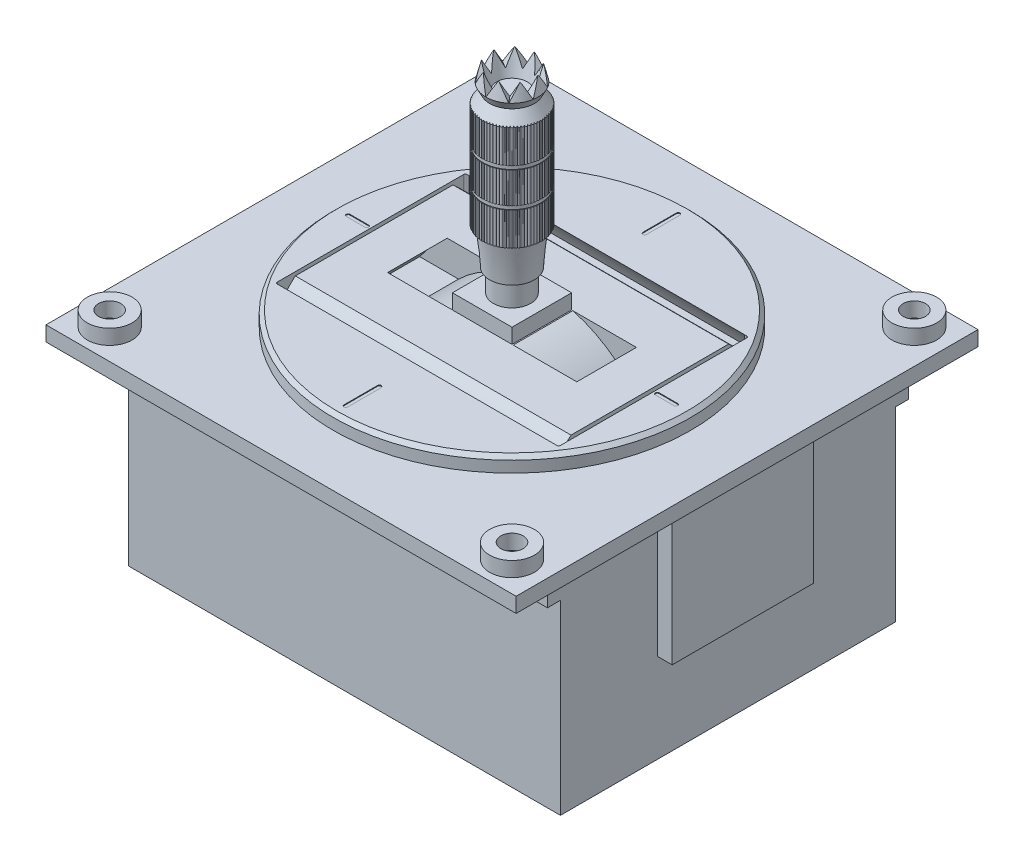
from build123d import *

# Parameters (mm, degrees)
SKETCH1_R                      = 24
CENTREOFFSET_DEPTH             = 2
MAINBODY_START                 = -2
SKETCH1_3_W                    = 63.1
SKETCH1_3_H                    = 62
SKETCH1_3_R                    = 3
SKETCH1_3_R_2                  = 24
MAINBODY_DEPTH                 = 2
SKETCH1_4_R                    = 3
SKETCH1_4_R_2                  = 1.5
SCREWHOLES_DEPTH               = 2
SCREWHOLES_2_DEPTH             = 2
SCREWHOLES_3_DEPTH             = 2
SCREWHOLES_4_DEPTH             = 2
SKETCH15_W                     = 37
SKETCH15_H                     = 1.5
PIVOTCUTOUTX_ANGLE             = 70
PIVOTCUTOUTX_OTHER_WAY_ANGLE   = 70
SKETCH20_W                     = 8
SKETCH20_H                     = 4
PIVOTCUTOUTY_ANGLE             = 90
PIVOTCUTOUTY_OTHER_WAY_ANGLE   = 90
SKETCH2_W                      = 8
SKETCH2_H                      = 8
STICKBASE_DEPTH                = 2
STICKBOTTOMSKETCH_R            = 2.5
STICKBOTTOM_DEPTH              = 3
SKETCH6_R                      = 4
SKETCH7_R                      = 4
SKETCH8_R                      = 3
SKETCH9_R                      = 3.5
SKETCH10_R                     = 3
CUT_EXTRUDE1_DEPTH             = 54.727576775
SPIKYBIT_COUNT                 = 9
INDENTSKETCH_W                 = 0.2
INDENTSKETCH_H                 = 0.5
CUT_EXTRUDE3_REACH             = 54.349
SKETCH14_R                     = 5
CUT_EXTRUDE3_DIRECTION_2_DEPTH = 53.348853856
CUT_EXTRUDE4_DEPTH             = 10
SKETCH17_W                     = 58
SKETCH17_H                     = 48.5
LIP_DEPTH                      = 4
SKETCH18_W                     = 58
SKETCH18_H                     = 45
BOTTOM_DEPTH                   = 25
SKETCH19_W                     = 2
SKETCH19_H                     = 19
BEARINGHOLDER_DEPTH            = 17
INDICATORS_DEPTH               = 0.1
CHAMFER2_SIZE                  = 0.5


with BuildPart() as part:
    # Sketch1 → CentreOffset (new body)
    with BuildSketch(Plane(origin=(0, 0, 0), x_dir=(1, 0, 0), z_dir=(0, 1, 0))):
        with Locations(Location((0, 0, 0), (0, 0, 90))):
            Circle(SKETCH1_R)
    extrude(amount=CENTREOFFSET_DEPTH)

    # Sketch1<3> → MainBody (add)
    # profile 1 of 2: a face of its own
    with BuildSketch(Plane(origin=(0, 0, 0), x_dir=(1, 0, 0), z_dir=(0, 1, 0)).offset(MAINBODY_START)):
        Rectangle(SKETCH1_3_W, SKETCH1_3_H)
        with Locations(Location((-27, 27, 0), (0, 0, 270))):
            Circle(SKETCH1_3_R, mode=Mode.SUBTRACT)
        with Locations(Location((27, 27, 0), (0, 0, 270))):
            Circle(SKETCH1_3_R, mode=Mode.SUBTRACT)
        with Locations(Location((0, 0, 0), (0, 0, 90))):
            Circle(SKETCH1_3_R_2, mode=Mode.SUBTRACT)
        with Locations(Location((-27, -27, 0), (0, 0, 270))):
            Circle(SKETCH1_3_R, mode=Mode.SUBTRACT)
        with Locations(Location((27, -27, 0), (0, 0, 270))):
            Circle(SKETCH1_3_R, mode=Mode.SUBTRACT)
    # profile 2 of 2: a face of its own
    with BuildSketch(Plane(origin=(0, 0, 0), x_dir=(1, 0, 0), z_dir=(0, 1, 0)).offset(MAINBODY_START)):
        with Locations(Location((0, 0, 0), (0, 0, 90))):
            Circle(SKETCH1_3_R_2)
    extrude(amount=MAINBODY_DEPTH)

    # Sketch15 → PivotCutoutX (revolve, cut)
    with BuildSketch(Plane.XY):
        with Locations((0, 6.75)):
            Rectangle(SKETCH15_W, SKETCH15_H)
    revolve(axis=Axis((-31.55, -10, 0), (1, 0, 0)), revolution_arc=PIVOTCUTOUTX_ANGLE, mode=Mode.SUBTRACT)

    # Sketch15 → PivotCutoutX other way (revolve, cut)
    with BuildSketch(Plane.XY):
        with Locations((0, 6.75)):
            Rectangle(SKETCH15_W, SKETCH15_H)
    revolve(axis=Axis((-31.55, -10, 0), (-1, 0, 0)), revolution_arc=PIVOTCUTOUTX_OTHER_WAY_ANGLE, mode=Mode.SUBTRACT)

    # Sketch20 → PivotCutoutY (revolve, cut)
    with BuildSketch(Plane(origin=(0, 0, 0), x_dir=(0, 0, -1), z_dir=(1, 0, 0))):
        with Locations((0, 4.55)):
            Rectangle(SKETCH20_W, SKETCH20_H)
    revolve(axis=Axis((0, -13.45, 22.5), (0, 0, -1)), revolution_arc=PIVOTCUTOUTY_ANGLE, mode=Mode.SUBTRACT)

    # Sketch20 → PivotCutoutY other way (revolve, cut)
    with BuildSketch(Plane(origin=(0, 0, 0), x_dir=(0, 0, -1), z_dir=(1, 0, 0))):
        with Locations((0, 4.55)):
            Rectangle(SKETCH20_W, SKETCH20_H)
    revolve(axis=Axis((0, -13.45, 22.5), (0, 0, 1)), revolution_arc=PIVOTCUTOUTY_OTHER_WAY_ANGLE, mode=Mode.SUBTRACT)

    # Sketch2 → StickBase (add)
    with BuildSketch(Plane(origin=(0, 2, 0), x_dir=(1, 0, 0), z_dir=(0, 1, 0))):
        Rectangle(SKETCH2_W, SKETCH2_H)
    extrude(amount=STICKBASE_DEPTH)

    # StickBottomSketch → StickBottom (add)
    with BuildSketch(Plane(origin=(0, 4, 0), x_dir=(1, 0, 0), z_dir=(0, 1, 0))):
        with Locations(Location((0, 0, 0), (0, 0, 270))):
            Circle(STICKBOTTOMSKETCH_R)
    extrude(amount=STICKBOTTOM_DEPTH)

    # Loft1: read off the stored shape, not the designer's step
    # Loft1: loft between two sections, ruled curve by curve
    loft1_from = [
        Edge.make_bspline([(-0.3666474, 7, 2.977510652), (5.588373905, 7, 3.710805452), (6.321668704, 7, -2.244215853), (0.3666474, 7, -2.977510652), (-5.588373905, 7, -3.710805452), (-6.321668704, 7, 2.244215853), (-0.3666474, 7, 2.977510652)], [0, 0, 0, 0, 0.5, 0.5, 0.5, 1, 1, 1, 1], 3, [1, 0.333333333, 0.333333333, 1, 0.333333333, 0.333333333, 1]),
    ]
    loft1_to = [
        Edge.make_bspline([(0.912945272, 12, 3.378835736), (7.670616744, 12, 1.552945192), (5.8447262, 12, -5.20472628), (-0.912945272, 12, -3.378835736), (-7.670616744, 12, -1.552945192), (-5.8447262, 12, 5.20472628), (0.912945272, 12, 3.378835736)], [0, 0, 0, 0, 0.5, 0.5, 0.5, 1, 1, 1, 1], 3, [1, 0.333333333, 0.333333333, 1, 0.333333333, 0.333333333, 1]),
    ]
    loft1 = Solid(Shell([*[Face.make_surface_from_curves(loft1_from[k], loft1_to[k]) for k in range(1)], Face(Wire(loft1_from)), Face(Wire(loft1_to))]))
    add(loft1)

    # Sketch6 → Loft2 section 0
    with BuildSketch(Plane(origin=(0, 12, 0), x_dir=(1, 0, 0), z_dir=(0, 1, 0))):
        Circle(SKETCH6_R)
    # Sketch7 → Loft2 section 1
    with BuildSketch(Plane(origin=(0, 26, 0), x_dir=(1, 0, 0), z_dir=(0, 1, 0))):
        Circle(SKETCH7_R)
    loft()

    # Sketch8 → section 1 of loft3
    with BuildSketch(Plane(origin=(0, 27.5, 0), x_dir=(1, 0, 0), z_dir=(0, 1, 0)), mode=Mode.PRIVATE) as loft3_s1:
        Circle(SKETCH8_R)
    # loft up to a face of the part (loft3)
    loft([Face(Wire([part.edges().sort_by_distance((-2.738188424, 26, -2.91587451))[0]])), loft3_s1.sketch])

    # Sketch9 → section 1 of loft4
    with BuildSketch(Plane(origin=(0, 28.5, 0), x_dir=(1, 0, 0), z_dir=(0, 1, 0)), mode=Mode.PRIVATE) as loft4_s1:
        Circle(SKETCH9_R)
    # loft up to a face of the part (loft4)
    loft([Face(Wire([part.edges().sort_by_distance((-2.053641318, 27.5, -2.186905882))[0]])), loft4_s1.sketch])

    # Sketch10 → section 1 of loft5
    with BuildSketch(Plane(origin=(0, 30.5, 0), x_dir=(1, 0, 0), z_dir=(0, 1, 0)), mode=Mode.PRIVATE) as loft5_s1:
        Circle(SKETCH10_R)
    # loft up to a face of the part (loft5)
    loft([Face(Wire([part.edges().sort_by_distance((-2.395914871, 28.5, -2.551390196))[0]])), loft5_s1.sketch])

    # Sketch12 → Cut-Revolve1 (revolve, cut)
    with BuildSketch(Plane.XY, mode=Mode.PRIVATE) as cut_revolve1_sk:
        Polygon((0, 30.5), (3, 30.5), (2.040418312, 27.5), (0, 27.5), align=None)
    revolve(cut_revolve1_sk.sketch.rotate(Axis((0, 30.5, 0), (0, -1, 0)), 180), axis=Axis((0, 30.5, 0), (0, -1, 0)), mode=Mode.SUBTRACT)

    # Sketch13 → Cut-Extrude1 (cut, through all)
    with BuildSketch(Plane.XY):
        Polygon((-1, 30.5), (1, 30.5), (0, 28.5), align=None)
    cut_extrude1 = extrude(amount=CUT_EXTRUDE1_DEPTH, mode=Mode.SUBTRACT)

    # SpikyBit: Cut-Extrude1 ×9 about axis
    spikybit_axis = Axis((0, 0, 0), (0, 1, 0))
    for i in range(1, SPIKYBIT_COUNT):
        add(cut_extrude1.rotate(spikybit_axis, i * 360 / SPIKYBIT_COUNT), mode=Mode.SUBTRACT)

    # IndentSketch → Cut-Revolve3 (revolve, cut)
    with BuildSketch(Plane.XY, mode=Mode.PRIVATE) as cut_revolve3_sk:
        with Locations((4, 16.666666667)):
            Rectangle(INDENTSKETCH_W, INDENTSKETCH_H)
        with Locations((4, 21.333333333)):
            Rectangle(INDENTSKETCH_W, INDENTSKETCH_H)
    revolve(cut_revolve3_sk.sketch.rotate(Axis((0, 30.5, 0), (0, -1, 0)), 180), axis=Axis((0, 30.5, 0), (0, -1, 0)), mode=Mode.SUBTRACT)

    # Cut-Extrude3: up to this face of the body (flat: up to its plane)
    cut_extrude3_end = Plane(part.part.faces().sort_by_distance((0, 4, 3.886862915))[0])
    # Sketch14 → Cut-Extrude3 (cut, up to the picked face)
    with BuildSketch(Plane(origin=(0, 26, 0), x_dir=(1, 0, 0), z_dir=(0, 1, 0)), mode=Mode.PRIVATE) as cut_extrude3_sk1:
        Circle(SKETCH14_R)
        with BuildLine():
            ThreePointArc((-0.170350384, 3.901665246), (0, 4.000017085), (0.170350384, 3.901665246))
            ThreePointArc((0.170350384, 3.901665246), (0.34862446, 3.984795813), (0.509754681, 3.871971217))
            ThreePointArc((0.509754681, 3.871971217), (0.694595678, 3.939247838), (0.845279438, 3.81280915))
            ThreePointArc((0.845279438, 3.81280915), (1.035280602, 3.863719808), (1.174371108, 3.724629303))
            ThreePointArc((1.174371108, 3.724629303), (1.368086417, 3.758786538), (1.494525105, 3.608102778))
            ThreePointArc((1.494525105, 3.608102778), (1.690480268, 3.625246633), (1.803304863, 3.464116412))
            ThreePointArc((1.803304863, 3.464116412), (2.000008543, 3.464116412), (2.098360383, 3.293766028))
            ThreePointArc((2.098360383, 3.293766028), (2.294315545, 3.276622173), (2.377446112, 3.098348096))
            ThreePointArc((2.377446112, 3.098348096), (2.571161421, 3.064190861), (2.638438042, 2.879349865))
            ThreePointArc((2.638438042, 2.879349865), (2.828439206, 2.828439206), (2.879349865, 2.638438042))
            ThreePointArc((2.879349865, 2.638438042), (3.064190861, 2.571161421), (3.098348096, 2.377446112))
            ThreePointArc((3.098348096, 2.377446112), (3.276622173, 2.294315545), (3.293766028, 2.098360383))
            ThreePointArc((3.293766028, 2.098360383), (3.464116412, 2.000008543), (3.464116412, 1.803304863))
            ThreePointArc((3.464116412, 1.803304863), (3.625246633, 1.690480268), (3.608102778, 1.494525105))
            ThreePointArc((3.608102778, 1.494525105), (3.758786538, 1.368086417), (3.724629303, 1.174371108))
            ThreePointArc((3.724629303, 1.174371108), (3.863719808, 1.035280602), (3.81280915, 0.845279438))
            ThreePointArc((3.81280915, 0.845279438), (3.939247838, 0.694595678), (3.871971217, 0.509754681))
            ThreePointArc((3.871971217, 0.509754681), (3.984795813, 0.34862446), (3.901665246, 0.170350384))
            ThreePointArc((3.901665246, 0.170350384), (4.000017085, 0), (3.901665246, -0.170350384))
            ThreePointArc((3.901665246, -0.170350384), (3.984795813, -0.34862446), (3.871971217, -0.509754681))
            ThreePointArc((3.871971217, -0.509754681), (3.939247838, -0.694595678), (3.81280915, -0.845279438))
            ThreePointArc((3.81280915, -0.845279438), (3.863719808, -1.035280602), (3.724629303, -1.174371108))
            ThreePointArc((3.724629303, -1.174371108), (3.758786538, -1.368086417), (3.608102778, -1.494525105))
            ThreePointArc((3.608102778, -1.494525105), (3.625246633, -1.690480268), (3.464116412, -1.803304863))
            ThreePointArc((3.464116412, -1.803304863), (3.464116412, -2.000008543), (3.293766028, -2.098360383))
            ThreePointArc((3.293766028, -2.098360383), (3.276622173, -2.294315545), (3.098348096, -2.377446112))
            ThreePointArc((3.098348096, -2.377446112), (3.064190861, -2.571161421), (2.879349865, -2.638438042))
            ThreePointArc((2.879349865, -2.638438042), (2.828439206, -2.828439206), (2.638438042, -2.879349865))
            ThreePointArc((2.638438042, -2.879349865), (2.571161421, -3.064190861), (2.377446112, -3.098348096))
            ThreePointArc((2.377446112, -3.098348096), (2.294315545, -3.276622173), (2.098360383, -3.293766028))
            ThreePointArc((2.098360383, -3.293766028), (2.000008543, -3.464116412), (1.803304863, -3.464116412))
            ThreePointArc((1.803304863, -3.464116412), (1.690480268, -3.625246633), (1.494525105, -3.608102778))
            ThreePointArc((1.494525105, -3.608102778), (1.368086417, -3.758786538), (1.174371108, -3.724629303))
            ThreePointArc((1.174371108, -3.724629303), (1.035280602, -3.863719808), (0.845279438, -3.81280915))
            ThreePointArc((0.845279438, -3.81280915), (0.694595678, -3.939247838), (0.509754681, -3.871971217))
            ThreePointArc((0.509754681, -3.871971217), (0.34862446, -3.984795813), (0.170350384, -3.901665246))
            ThreePointArc((0.170350384, -3.901665246), (0, -4.000017085), (-0.170350384, -3.901665246))
            ThreePointArc((-0.170350384, -3.901665246), (-0.34862446, -3.984795813), (-0.509754681, -3.871971217))
            ThreePointArc((-0.509754681, -3.871971217), (-0.694595678, -3.939247838), (-0.845279438, -3.81280915))
            ThreePointArc((-0.845279438, -3.81280915), (-1.035280602, -3.863719808), (-1.174371108, -3.724629303))
            ThreePointArc((-1.174371108, -3.724629303), (-1.368086417, -3.758786538), (-1.494525105, -3.608102778))
            ThreePointArc((-1.494525105, -3.608102778), (-1.690480268, -3.625246633), (-1.803304863, -3.464116412))
            ThreePointArc((-1.803304863, -3.464116412), (-2.000008543, -3.464116412), (-2.098360383, -3.293766028))
            ThreePointArc((-2.098360383, -3.293766028), (-2.294315545, -3.276622173), (-2.377446112, -3.098348096))
            ThreePointArc((-2.377446112, -3.098348096), (-2.571161421, -3.064190861), (-2.638438042, -2.879349865))
            ThreePointArc((-2.638438042, -2.879349865), (-2.828439206, -2.828439206), (-2.879349865, -2.638438042))
            ThreePointArc((-2.879349865, -2.638438042), (-3.064190861, -2.571161421), (-3.098348096, -2.377446112))
            ThreePointArc((-3.098348096, -2.377446112), (-3.276622173, -2.294315545), (-3.293766028, -2.098360383))
            ThreePointArc((-3.293766028, -2.098360383), (-3.464116412, -2.000008543), (-3.464116412, -1.803304863))
            ThreePointArc((-3.464116412, -1.803304863), (-3.625246633, -1.690480268), (-3.608102778, -1.494525105))
            ThreePointArc((-3.608102778, -1.494525105), (-3.758786538, -1.368086417), (-3.724629303, -1.174371108))
            ThreePointArc((-3.724629303, -1.174371108), (-3.863719808, -1.035280602), (-3.81280915, -0.845279438))
            ThreePointArc((-3.81280915, -0.845279438), (-3.939247838, -0.694595678), (-3.871971217, -0.509754681))
            ThreePointArc((-3.871971217, -0.509754681), (-3.984795813, -0.34862446), (-3.901665246, -0.170350384))
            ThreePointArc((-3.901665246, -0.170350384), (-4.000017085, 0), (-3.901665246, 0.170350384))
            ThreePointArc((-3.901665246, 0.170350384), (-3.984795813, 0.34862446), (-3.871971217, 0.509754681))
            ThreePointArc((-3.871971217, 0.509754681), (-3.939247838, 0.694595678), (-3.81280915, 0.845279438))
            ThreePointArc((-3.81280915, 0.845279438), (-3.863719808, 1.035280602), (-3.724629303, 1.174371108))
            ThreePointArc((-3.724629303, 1.174371108), (-3.758786538, 1.368086417), (-3.608102778, 1.494525105))
            ThreePointArc((-3.608102778, 1.494525105), (-3.625246633, 1.690480268), (-3.464116412, 1.803304863))
            ThreePointArc((-3.464116412, 1.803304863), (-3.464116412, 2.000008543), (-3.293766028, 2.098360383))
            ThreePointArc((-3.293766028, 2.098360383), (-3.276622173, 2.294315545), (-3.098348096, 2.377446112))
            ThreePointArc((-3.098348096, 2.377446112), (-3.064190861, 2.571161421), (-2.879349865, 2.638438042))
            ThreePointArc((-2.879349865, 2.638438042), (-2.828439206, 2.828439206), (-2.638438042, 2.879349865))
            ThreePointArc((-2.638438042, 2.879349865), (-2.571161421, 3.064190861), (-2.377446112, 3.098348096))
            ThreePointArc((-2.377446112, 3.098348096), (-2.294315545, 3.276622173), (-2.098360383, 3.293766028))
            ThreePointArc((-2.098360383, 3.293766028), (-2.000008543, 3.464116412), (-1.803304863, 3.464116412))
            ThreePointArc((-1.803304863, 3.464116412), (-1.690480268, 3.625246633), (-1.494525105, 3.608102778))
            ThreePointArc((-1.494525105, 3.608102778), (-1.368086417, 3.758786538), (-1.174371108, 3.724629303))
            ThreePointArc((-1.174371108, 3.724629303), (-1.035280602, 3.863719808), (-0.845279438, 3.81280915))
            ThreePointArc((-0.845279438, 3.81280915), (-0.694595678, 3.939247838), (-0.509754681, 3.871971217))
            ThreePointArc((-0.509754681, 3.871971217), (-0.34862446, 3.984795813), (-0.170350384, 3.901665246))
        make_face(mode=Mode.SUBTRACT)
    cut_extrude3_tool1 = split(extrude(cut_extrude3_sk1.sketch, amount=-CUT_EXTRUDE3_REACH, mode=Mode.PRIVATE), bisect_by=cut_extrude3_end, keep=Keep.BOTH, mode=Mode.PRIVATE)
    add(cut_extrude3_tool1.solids().sort_by(Axis((-4.858579, 26, 0), (0, -1, 0)))[0], mode=Mode.SUBTRACT)

    # Sketch14 → Cut-Extrude3 direction 2 (cut)
    with BuildSketch(Plane(origin=(0, 26, 0), x_dir=(1, 0, 0), z_dir=(0, 1, 0))):
        Circle(SKETCH14_R)
        with BuildLine():
            ThreePointArc((-0.170350384, 3.901665246), (0, 4.000017085), (0.170350384, 3.901665246))
            ThreePointArc((0.170350384, 3.901665246), (0.34862446, 3.984795813), (0.509754681, 3.871971217))
            ThreePointArc((0.509754681, 3.871971217), (0.694595678, 3.939247838), (0.845279438, 3.81280915))
            ThreePointArc((0.845279438, 3.81280915), (1.035280602, 3.863719808), (1.174371108, 3.724629303))
            ThreePointArc((1.174371108, 3.724629303), (1.368086417, 3.758786538), (1.494525105, 3.608102778))
            ThreePointArc((1.494525105, 3.608102778), (1.690480268, 3.625246633), (1.803304863, 3.464116412))
            ThreePointArc((1.803304863, 3.464116412), (2.000008543, 3.464116412), (2.098360383, 3.293766028))
            ThreePointArc((2.098360383, 3.293766028), (2.294315545, 3.276622173), (2.377446112, 3.098348096))
            ThreePointArc((2.377446112, 3.098348096), (2.571161421, 3.064190861), (2.638438042, 2.879349865))
            ThreePointArc((2.638438042, 2.879349865), (2.828439206, 2.828439206), (2.879349865, 2.638438042))
            ThreePointArc((2.879349865, 2.638438042), (3.064190861, 2.571161421), (3.098348096, 2.377446112))
            ThreePointArc((3.098348096, 2.377446112), (3.276622173, 2.294315545), (3.293766028, 2.098360383))
            ThreePointArc((3.293766028, 2.098360383), (3.464116412, 2.000008543), (3.464116412, 1.803304863))
            ThreePointArc((3.464116412, 1.803304863), (3.625246633, 1.690480268), (3.608102778, 1.494525105))
            ThreePointArc((3.608102778, 1.494525105), (3.758786538, 1.368086417), (3.724629303, 1.174371108))
            ThreePointArc((3.724629303, 1.174371108), (3.863719808, 1.035280602), (3.81280915, 0.845279438))
            ThreePointArc((3.81280915, 0.845279438), (3.939247838, 0.694595678), (3.871971217, 0.509754681))
            ThreePointArc((3.871971217, 0.509754681), (3.984795813, 0.34862446), (3.901665246, 0.170350384))
            ThreePointArc((3.901665246, 0.170350384), (4.000017085, 0), (3.901665246, -0.170350384))
            ThreePointArc((3.901665246, -0.170350384), (3.984795813, -0.34862446), (3.871971217, -0.509754681))
            ThreePointArc((3.871971217, -0.509754681), (3.939247838, -0.694595678), (3.81280915, -0.845279438))
            ThreePointArc((3.81280915, -0.845279438), (3.863719808, -1.035280602), (3.724629303, -1.174371108))
            ThreePointArc((3.724629303, -1.174371108), (3.758786538, -1.368086417), (3.608102778, -1.494525105))
            ThreePointArc((3.608102778, -1.494525105), (3.625246633, -1.690480268), (3.464116412, -1.803304863))
            ThreePointArc((3.464116412, -1.803304863), (3.464116412, -2.000008543), (3.293766028, -2.098360383))
            ThreePointArc((3.293766028, -2.098360383), (3.276622173, -2.294315545), (3.098348096, -2.377446112))
            ThreePointArc((3.098348096, -2.377446112), (3.064190861, -2.571161421), (2.879349865, -2.638438042))
            ThreePointArc((2.879349865, -2.638438042), (2.828439206, -2.828439206), (2.638438042, -2.879349865))
            ThreePointArc((2.638438042, -2.879349865), (2.571161421, -3.064190861), (2.377446112, -3.098348096))
            ThreePointArc((2.377446112, -3.098348096), (2.294315545, -3.276622173), (2.098360383, -3.293766028))
            ThreePointArc((2.098360383, -3.293766028), (2.000008543, -3.464116412), (1.803304863, -3.464116412))
            ThreePointArc((1.803304863, -3.464116412), (1.690480268, -3.625246633), (1.494525105, -3.608102778))
            ThreePointArc((1.494525105, -3.608102778), (1.368086417, -3.758786538), (1.174371108, -3.724629303))
            ThreePointArc((1.174371108, -3.724629303), (1.035280602, -3.863719808), (0.845279438, -3.81280915))
            ThreePointArc((0.845279438, -3.81280915), (0.694595678, -3.939247838), (0.509754681, -3.871971217))
            ThreePointArc((0.509754681, -3.871971217), (0.34862446, -3.984795813), (0.170350384, -3.901665246))
            ThreePointArc((0.170350384, -3.901665246), (0, -4.000017085), (-0.170350384, -3.901665246))
            ThreePointArc((-0.170350384, -3.901665246), (-0.34862446, -3.984795813), (-0.509754681, -3.871971217))
            ThreePointArc((-0.509754681, -3.871971217), (-0.694595678, -3.939247838), (-0.845279438, -3.81280915))
            ThreePointArc((-0.845279438, -3.81280915), (-1.035280602, -3.863719808), (-1.174371108, -3.724629303))
            ThreePointArc((-1.174371108, -3.724629303), (-1.368086417, -3.758786538), (-1.494525105, -3.608102778))
            ThreePointArc((-1.494525105, -3.608102778), (-1.690480268, -3.625246633), (-1.803304863, -3.464116412))
            ThreePointArc((-1.803304863, -3.464116412), (-2.000008543, -3.464116412), (-2.098360383, -3.293766028))
            ThreePointArc((-2.098360383, -3.293766028), (-2.294315545, -3.276622173), (-2.377446112, -3.098348096))
            ThreePointArc((-2.377446112, -3.098348096), (-2.571161421, -3.064190861), (-2.638438042, -2.879349865))
            ThreePointArc((-2.638438042, -2.879349865), (-2.828439206, -2.828439206), (-2.879349865, -2.638438042))
            ThreePointArc((-2.879349865, -2.638438042), (-3.064190861, -2.571161421), (-3.098348096, -2.377446112))
            ThreePointArc((-3.098348096, -2.377446112), (-3.276622173, -2.294315545), (-3.293766028, -2.098360383))
            ThreePointArc((-3.293766028, -2.098360383), (-3.464116412, -2.000008543), (-3.464116412, -1.803304863))
            ThreePointArc((-3.464116412, -1.803304863), (-3.625246633, -1.690480268), (-3.608102778, -1.494525105))
            ThreePointArc((-3.608102778, -1.494525105), (-3.758786538, -1.368086417), (-3.724629303, -1.174371108))
            ThreePointArc((-3.724629303, -1.174371108), (-3.863719808, -1.035280602), (-3.81280915, -0.845279438))
            ThreePointArc((-3.81280915, -0.845279438), (-3.939247838, -0.694595678), (-3.871971217, -0.509754681))
            ThreePointArc((-3.871971217, -0.509754681), (-3.984795813, -0.34862446), (-3.901665246, -0.170350384))
            ThreePointArc((-3.901665246, -0.170350384), (-4.000017085, 0), (-3.901665246, 0.170350384))
            ThreePointArc((-3.901665246, 0.170350384), (-3.984795813, 0.34862446), (-3.871971217, 0.509754681))
            ThreePointArc((-3.871971217, 0.509754681), (-3.939247838, 0.694595678), (-3.81280915, 0.845279438))
            ThreePointArc((-3.81280915, 0.845279438), (-3.863719808, 1.035280602), (-3.724629303, 1.174371108))
            ThreePointArc((-3.724629303, 1.174371108), (-3.758786538, 1.368086417), (-3.608102778, 1.494525105))
            ThreePointArc((-3.608102778, 1.494525105), (-3.625246633, 1.690480268), (-3.464116412, 1.803304863))
            ThreePointArc((-3.464116412, 1.803304863), (-3.464116412, 2.000008543), (-3.293766028, 2.098360383))
            ThreePointArc((-3.293766028, 2.098360383), (-3.276622173, 2.294315545), (-3.098348096, 2.377446112))
            ThreePointArc((-3.098348096, 2.377446112), (-3.064190861, 2.571161421), (-2.879349865, 2.638438042))
            ThreePointArc((-2.879349865, 2.638438042), (-2.828439206, 2.828439206), (-2.638438042, 2.879349865))
            ThreePointArc((-2.638438042, 2.879349865), (-2.571161421, 3.064190861), (-2.377446112, 3.098348096))
            ThreePointArc((-2.377446112, 3.098348096), (-2.294315545, 3.276622173), (-2.098360383, 3.293766028))
            ThreePointArc((-2.098360383, 3.293766028), (-2.000008543, 3.464116412), (-1.803304863, 3.464116412))
            ThreePointArc((-1.803304863, 3.464116412), (-1.690480268, 3.625246633), (-1.494525105, 3.608102778))
            ThreePointArc((-1.494525105, 3.608102778), (-1.368086417, 3.758786538), (-1.174371108, 3.724629303))
            ThreePointArc((-1.174371108, 3.724629303), (-1.035280602, 3.863719808), (-0.845279438, 3.81280915))
            ThreePointArc((-0.845279438, 3.81280915), (-0.694595678, 3.939247838), (-0.509754681, 3.871971217))
            ThreePointArc((-0.509754681, 3.871971217), (-0.34862446, 3.984795813), (-0.170350384, 3.901665246))
        make_face(mode=Mode.SUBTRACT)
    extrude(amount=CUT_EXTRUDE3_DIRECTION_2_DEPTH, mode=Mode.SUBTRACT)

    # Sketch16 → Cut-Extrude4 (cut)
    with BuildSketch(Plane(origin=(0, 2, 0), x_dir=(1, 0, 0), z_dir=(0, 1, 0))):
        with BuildLine():
            Line((18.5, 12.737739203), (18.75, 12.737739203))
            ThreePointArc((18.75, 12.737739203), (18.926776695, 12.664515898), (19, 12.487739203))
            Line((19, 12.487739203), (19, -12.487739203))
            ThreePointArc((19, -12.487739203), (18.926776695, -12.664515898), (18.75, -12.737739203))
            Line((18.75, -12.737739203), (18.5, -12.737739203))
            Line((18.5, -12.737739203), (18.5, 12.737739203))
        make_face()
        with BuildLine():
            Line((-18.5, -12.737739203), (-18.75, -12.737739203))
            ThreePointArc((-18.75, -12.737739203), (-18.926776695, -12.664515898), (-19, -12.487739203))
            Line((-19, -12.487739203), (-19, 12.487739203))
            ThreePointArc((-19, 12.487739203), (-18.926776695, 12.664515898), (-18.75, 12.737739203))
            Line((-18.75, 12.737739203), (-18.5, 12.737739203))
            Line((-18.5, 12.737739203), (-18.5, -12.737739203))
        make_face()
    extrude(amount=-CUT_EXTRUDE4_DEPTH, mode=Mode.SUBTRACT)

    # Sketch17 → Lip (add)
    with BuildSketch(Plane.XZ.offset(2)):
        Rectangle(SKETCH17_W, SKETCH17_H)
    extrude(amount=LIP_DEPTH)

    # Sketch18 → Bottom (add)
    with BuildSketch(Plane.XZ.offset(6)):
        Rectangle(SKETCH18_W, SKETCH18_H)
    extrude(amount=BOTTOM_DEPTH)

    # Sketch19 → BearingHolder (add)
    with BuildSketch(Plane(origin=(0, -2, 0), x_dir=(-1, 0, 0), z_dir=(0, -1, 0))):
        with Locations((-30, 0)):
            Rectangle(SKETCH19_W, SKETCH19_H)
    extrude(amount=BEARINGHOLDER_DEPTH)

    # Sketch21 → Indicators (cut)
    with BuildSketch(Plane(origin=(0, 2, 0), x_dir=(1, 0, 0), z_dir=(0, 1, 0))):
        with BuildLine():
            Line((0.25, -17.8), (0.25, -22.3))
            ThreePointArc((0.25, -22.3), (0, -22.55), (-0.25, -22.3))
            Line((-0.25, -22.3), (-0.25, -17.8))
            ThreePointArc((-0.25, -17.8), (0, -17.55), (0.25, -17.8))
        make_face()
        with BuildLine():
            Line((19.5, 0.25), (22, 0.25))
            ThreePointArc((22, 0.25), (22.25, 0), (22, -0.25))
            Line((22, -0.25), (19.5, -0.25))
            ThreePointArc((19.5, -0.25), (19.25, 0), (19.5, 0.25))
        make_face()
        with BuildLine():
            Line((0.25, 17.8), (0.25, 22.3))
            ThreePointArc((0.25, 22.3), (0, 22.55), (-0.25, 22.3))
            Line((-0.25, 22.3), (-0.25, 17.8))
            ThreePointArc((-0.25, 17.8), (0, 17.55), (0.25, 17.8))
        make_face()
        with BuildLine():
            Line((-19.5, 0.25), (-22, 0.25))
            ThreePointArc((-22, 0.25), (-22.25, 0), (-22, -0.25))
            Line((-22, -0.25), (-19.5, -0.25))
            ThreePointArc((-19.5, -0.25), (-19.25, 0), (-19.5, 0.25))
        make_face()
    extrude(amount=-INDICATORS_DEPTH, mode=Mode.SUBTRACT)

    # Chamfer2
    chamfer2_edges = [part.edges().sort_by_distance(p)[0] for p in [
        (0, 2, 24),
    ]]
    chamfer(chamfer2_edges, length=CHAMFER2_SIZE)


with BuildPart() as body_2:
    # Sketch1<4> → ScrewHoles (new body)
    with BuildSketch(Plane(origin=(0, 0, 0), x_dir=(1, 0, 0), z_dir=(0, 1, 0))):
        with Locations(Location((-27, -27, 0), (0, 0, 270))):
            Circle(SKETCH1_4_R)
        with Locations(Location((-27, -27, 0), (0, 0, 270))):
            Circle(SKETCH1_4_R_2, mode=Mode.SUBTRACT)
    extrude(amount=SCREWHOLES_DEPTH)


with BuildPart() as body_3:
    # Sketch1<4> → ScrewHoles 2 (new body)
    with BuildSketch(Plane(origin=(0, 0, 0), x_dir=(1, 0, 0), z_dir=(0, 1, 0))):
        with Locations(Location((-27, 27, 0), (0, 0, 270))):
            Circle(SKETCH1_4_R)
        with Locations(Location((-27, 27, 0), (0, 0, 270))):
            Circle(SKETCH1_4_R_2, mode=Mode.SUBTRACT)
    extrude(amount=SCREWHOLES_2_DEPTH)


with BuildPart() as body_4:
    # Sketch1<4> → ScrewHoles 3 (new body)
    with BuildSketch(Plane(origin=(0, 0, 0), x_dir=(1, 0, 0), z_dir=(0, 1, 0))):
        with Locations(Location((27, 27, 0), (0, 0, 270))):
            Circle(SKETCH1_4_R)
        with Locations(Location((27, 27, 0), (0, 0, 270))):
            Circle(SKETCH1_4_R_2, mode=Mode.SUBTRACT)
    extrude(amount=SCREWHOLES_3_DEPTH)


with BuildPart() as body_5:
    # Sketch1<4> → ScrewHoles 4 (new body)
    with BuildSketch(Plane(origin=(0, 0, 0), x_dir=(1, 0, 0), z_dir=(0, 1, 0))):
        with Locations(Location((27, -27, 0), (0, 0, 270))):
            Circle(SKETCH1_4_R)
        with Locations(Location((27, -27, 0), (0, 0, 270))):
            Circle(SKETCH1_4_R_2, mode=Mode.SUBTRACT)
    extrude(amount=SCREWHOLES_4_DEPTH)


solid = Compound([part.part, body_2.part, body_3.part, body_4.part, body_5.part])
